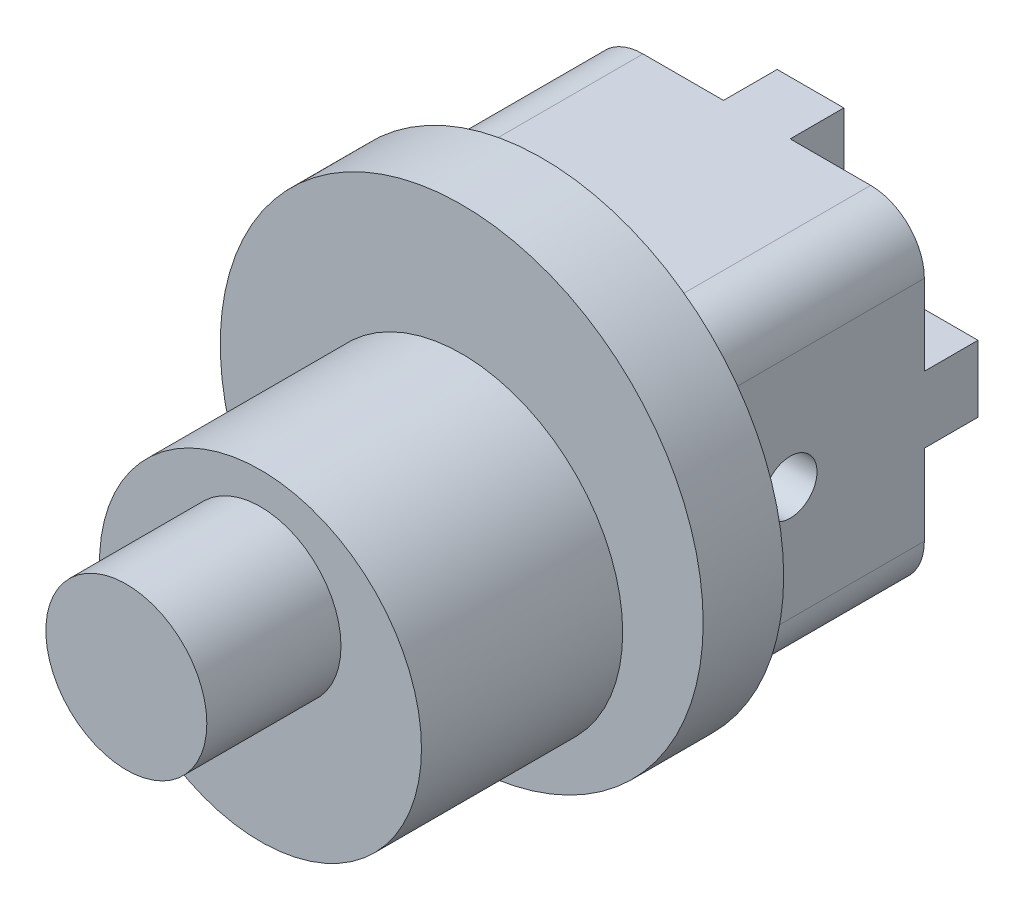
from build123d import *

# Parameters (mm, degrees)
SKETCH3_R           = 9
BOSS_EXTRUDE3_DEPTH = 3
SKETCH4_R           = 6
BOSS_EXTRUDE4_DEPTH = 7.5
SKETCH5_R           = 3
BOSS_EXTRUDE5_DEPTH = 5
BOSS_EXTRUDE8_DEPTH = 2
BOSS_EXTRUDE9_START = 2
BOSS_EXTRUDE9_DEPTH = 8
SKETCH6_R           = 1
CUT_EXTRUDE1_DEPTH  = 15


with BuildPart() as part:
    # Sketch3 → Boss-Extrude3 (new body)
    with BuildSketch(Plane.XY.offset(10)):
        Circle(SKETCH3_R)
    extrude(amount=BOSS_EXTRUDE3_DEPTH)

    # Sketch4 → Boss-Extrude4 (add)
    with BuildSketch(Plane.XY.offset(13)):
        with Locations((0, -1.812)):
            Circle(SKETCH4_R)
    extrude(amount=BOSS_EXTRUDE4_DEPTH)

    # Sketch5 → Boss-Extrude5 (add)
    with BuildSketch(Plane.XY.offset(20.5)):
        Circle(SKETCH5_R)
    extrude(amount=BOSS_EXTRUDE5_DEPTH)



with BuildPart() as body_2:
    # Sketch1 → Boss-Extrude8 (new body)
    with BuildSketch(Plane.XY):
        with BuildLine():
            Line((1.242640687, 4.242640687), (1.242640687, 6.242640687))
            Line((1.242640687, 6.242640687), (-1.242640687, 6.242640687))
            Line((-1.242640687, 6.242640687), (-1.242640687, 4.242640687))
            ThreePointArc((-1.242640687, 4.242640687), (-2.121320344, 2.121320344), (-4.242640687, 1.242640687))
            Line((-4.242640687, 1.242640687), (-6.242640687, 1.242640687))
            Line((-6.242640687, 1.242640687), (-6.242640687, -1.242640687))
            Line((-6.242640687, -1.242640687), (-4.242640687, -1.242640687))
            ThreePointArc((-4.242640687, -1.242640687), (-2.121320344, -2.121320343), (-1.242640687, -4.242640687))
            Line((-1.242640687, -4.242640687), (-1.242640687, -6.242640687))
            Line((-1.242640687, -6.242640687), (1.242640687, -6.242640687))
            Line((1.242640687, -6.242640687), (1.242640687, -4.242640687))
            ThreePointArc((1.242640687, -4.242640687), (2.121320343, -2.121320343), (4.242640687, -1.242640687))
            Line((4.242640687, -1.242640687), (6.242640687, -1.242640687))
            Line((6.242640687, -1.242640687), (6.242640687, 1.242640687))
            Line((6.242640687, 1.242640687), (4.242640687, 1.242640687))
            ThreePointArc((4.242640687, 1.242640687), (2.121320343, 2.121320344), (1.242640687, 4.242640687))
        make_face()
    extrude(amount=BOSS_EXTRUDE8_DEPTH)


with BuildPart() as part_1:
    add(part.part)

    add(body_2.part)  # Boss-Extrude9 merges body 2
    # Sketch1<7> → Boss-Extrude9 (add)
    with BuildSketch(Plane.XY.offset(BOSS_EXTRUDE9_START)):
        with BuildLine():
            Line((4.242640687, 6.242640687), (-4.242640687, 6.242640687))
            ThreePointArc((-4.242640687, 6.242640687), (-5.656854249, 5.656854249), (-6.242640687, 4.242640687))
            Line((-6.242640687, 4.242640687), (-6.242640687, -4.242640687))
            ThreePointArc((-6.242640687, -4.242640687), (-5.656854249, -5.656854249), (-4.242640687, -6.242640687))
            Line((-4.242640687, -6.242640687), (4.242640687, -6.242640687))
            ThreePointArc((4.242640687, -6.242640687), (5.656854249, -5.656854249), (6.242640687, -4.242640687))
            Line((6.242640687, -4.242640687), (6.242640687, 4.242640687))
            ThreePointArc((6.242640687, 4.242640687), (5.656854249, 5.65685425), (4.242640687, 6.242640687))
        make_face()
    extrude(amount=BOSS_EXTRUDE9_DEPTH)

    # Sketch6 → Cut-Extrude1 (cut)
    with BuildSketch(Plane(origin=(6.242640687, 0, 0), x_dir=(0, 0, -1), z_dir=(1, 0, 0))):
        with Locations((-7, 0)):
            Circle(SKETCH6_R)
    extrude(amount=-CUT_EXTRUDE1_DEPTH, mode=Mode.SUBTRACT)


solid = part_1.part
